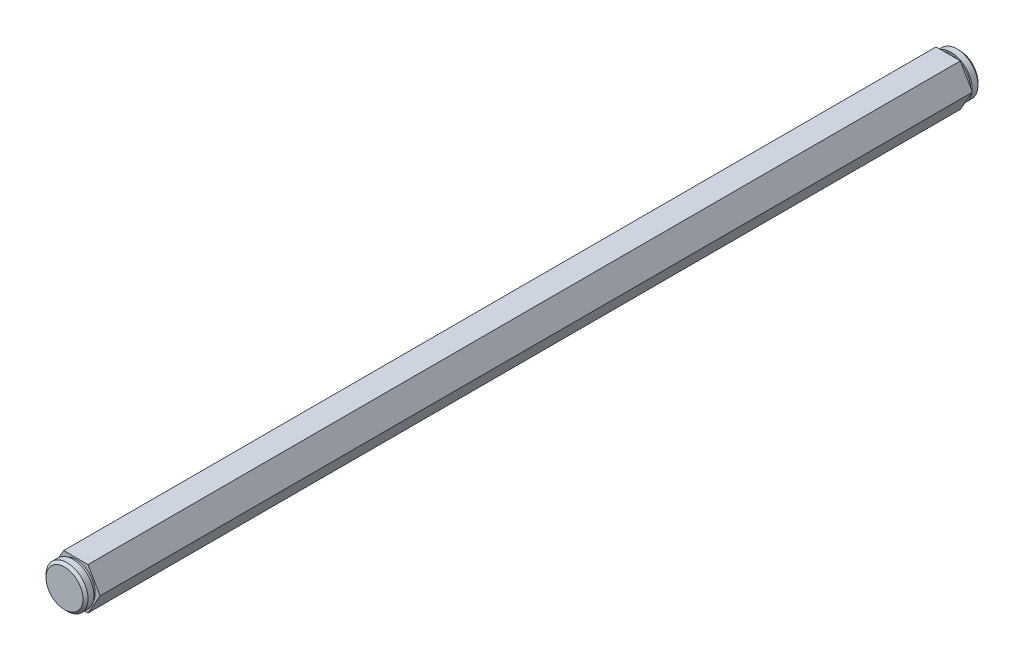
from build123d import *

# Parameters (mm, degrees)
BOSS_EXTRUDE1_DEPTH      = 131.7625
SKETCH2_R                = 5.8547
BOSS_EXTRUDE2_DEPTH      = 0.889
SKETCH3_R                = 6.35
BOSS_EXTRUDE3_DEPTH      = 2.54
CHAMFER1_SIZE            = 0.762
CHAMFER1_OF_MIRROR1_SIZE = 0.762


with BuildPart() as part:
    # Sketch1 → Boss-Extrude1 (new, symmetric)
    with BuildSketch(Plane.XY):
        Polygon((7.332348419, 0), (3.666174209, 6.35), (-3.666174209, 6.35), (-7.332348419, 0), (-3.666174209, -6.35), (3.666174209, -6.35), align=None)
    extrude(amount=BOSS_EXTRUDE1_DEPTH, both=True)

    # Sketch2 → Boss-Extrude2 (add)
    with BuildSketch(Plane.XY.offset(131.7625)):
        Circle(SKETCH2_R)
    boss_extrude2 = extrude(amount=BOSS_EXTRUDE2_DEPTH)

    # Sketch3 → Boss-Extrude3 (add)
    with BuildSketch(Plane.XY.offset(132.6515)):
        Circle(SKETCH3_R)
    boss_extrude3 = extrude(amount=BOSS_EXTRUDE3_DEPTH)

    # Chamfer1
    chamfer1_edges = [part.edges().sort_by_distance(p)[0] for p in [
        (-6.35, 0, 135.1915),
    ]]
    chamfer(chamfer1_edges, length=CHAMFER1_SIZE)

    # Mirror1: Boss-Extrude2, Boss-Extrude3 across plane
    add(boss_extrude2.mirror(Plane.XY))
    add(boss_extrude3.mirror(Plane.XY))

    # Chamfer1 of Mirror1
    chamfer1_of_mirror1_edges = [part.edges().sort_by_distance(p)[0] for p in [
        (-6.35, 0, -135.1915),
    ]]
    chamfer(chamfer1_of_mirror1_edges, length=CHAMFER1_OF_MIRROR1_SIZE)


solid = part.part
